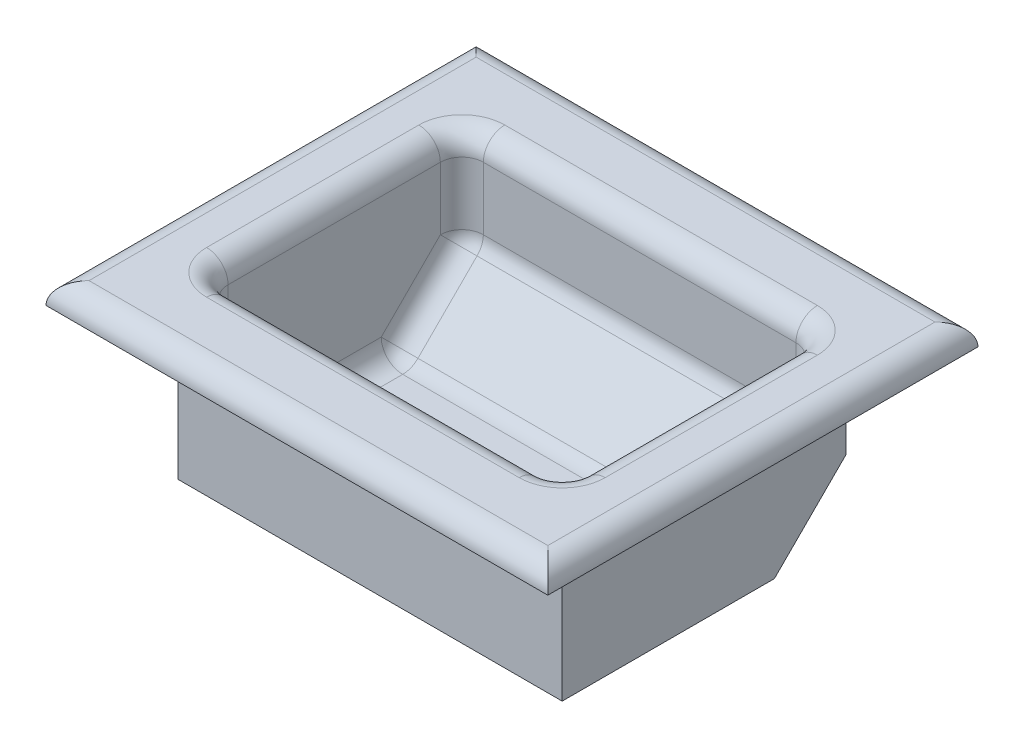
from build123d import *

# Parameters (mm, degrees)
SKETCH1_W           = 53.6
SKETCH1_H           = 39.6
BOSS_EXTRUDE1_DEPTH = 2
SKETCH2_W           = 53.6
SKETCH2_H           = 39.6
SKETCH2_W_2         = 49.6
SKETCH2_H_2         = 35.6
BOSS_EXTRUDE2_DEPTH = 20
SKETCH3_W           = 70
SKETCH3_H           = 60
SKETCH3_W_2         = 49.6
SKETCH3_H_2         = 35.6
BOSS_EXTRUDE3_DEPTH = 3
CHAMFER1_SIZE       = 10
FILLET1_R           = 3


with BuildPart() as part:
    # Sketch1 → Boss-Extrude1 (new body)
    with BuildSketch(Plane(origin=(0, 0, 0), x_dir=(1, 0, 0), z_dir=(0, 1, 0))):
        Rectangle(SKETCH1_W, SKETCH1_H)
    extrude(amount=BOSS_EXTRUDE1_DEPTH)

    # Sketch2 → Boss-Extrude2 (add)
    with BuildSketch(Plane(origin=(0, 2, 0), x_dir=(1, 0, 0), z_dir=(0, 1, 0))):
        Rectangle(SKETCH2_W, SKETCH2_H)
        Rectangle(SKETCH2_W_2, SKETCH2_H_2, mode=Mode.SUBTRACT)
    extrude(amount=BOSS_EXTRUDE2_DEPTH)

    # Sketch3 → Boss-Extrude3 (add)
    with BuildSketch(Plane(origin=(0, 22, 0), x_dir=(1, 0, 0), z_dir=(0, 1, 0))):
        Rectangle(SKETCH3_W, SKETCH3_H)
        Rectangle(SKETCH3_W_2, SKETCH3_H_2, mode=Mode.SUBTRACT)
    extrude(amount=BOSS_EXTRUDE3_DEPTH)

    # Chamfer1
    chamfer1_edges = [part.edges().sort_by_distance(p)[0] for p in [
        (0, 2, -17.8),
        (0, 0, -19.8),
    ]]
    chamfer(chamfer1_edges, length=CHAMFER1_SIZE)

    # Fillet1
    fillet1_edges = [part.edges().sort_by_distance(p)[0] for p in [
        (24.8, 13.5, 17.8),
        (0, 25, 17.8),
        (-24.8, 13.5, 17.8),
        (0, 2, 17.8),
        (24.8, 18.5, -17.8),
        (-24.8, 18.5, -17.8),
        (24.8, 2, 5),
        (-24.8, 2, 5),
        (24.8, 25, 0),
        (0, 25, -17.8),
        (-24.8, 25, 0),
        (0, 25, 30),
        (0, 25, -30),
        (35, 25, 0),
        (-35, 25, 0),
        (0, 12, -17.8),
        (24.8, 7, -12.8),
        (-24.8, 7, -12.8),
        (0, 2, -7.8),
    ]]
    fillet(fillet1_edges, radius=FILLET1_R - 0.0001)  # a hair under: the kernel refuses the full size


solid = part.part
